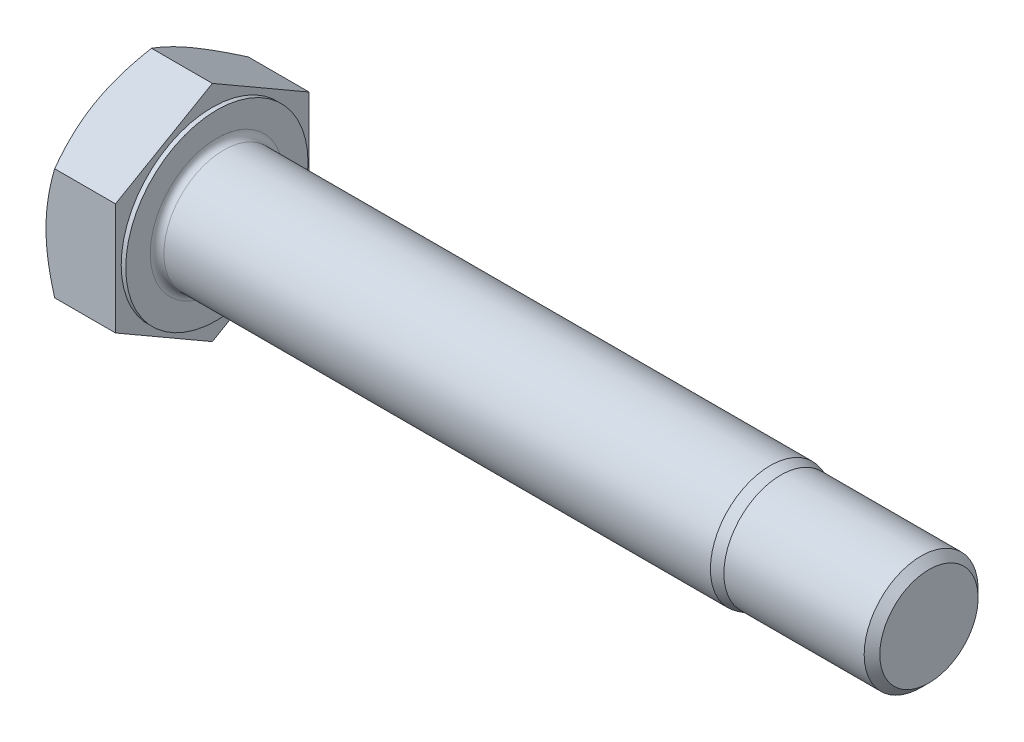
from build123d import *

# Parameters (mm, degrees)
BASEHEAD_DEPTH = 13
SKETCH4_W      = 0.8
SKETCH4_H      = 3.629909152
HEADFILLET_R   = 1.2


with BuildPart() as part:
    # HeadSke → BaseHead (new body)
    with BuildSketch(Plane(origin=(0, 0, 0), x_dir=(0, 0, -1), z_dir=(1, 0, 0))):
        Polygon((17, 9.814954576), (17, -9.814954576), (0, -19.629909152), (-17, -9.814954576), (-17, 9.814954576), (0, 19.629909152), align=None)
    extrude(amount=BASEHEAD_DEPTH)

    # BodySke → BaseBody (revolve)
    with BuildSketch(Plane.XY):
        Polygon((0, 10.5), (0, 0), (138, 0), (138, 8.626), (136.626, 10), (112, 10), (110.133974596, 10.5), align=None)
    revolve(axis=Axis((0, 0, 0), (1, 0, 0)))

    # Sketch3 → HeadChamfer (revolve, cut)
    with BuildSketch(Plane(origin=(0, 0, 0), x_dir=(1, 0, 0), z_dir=(0, 1, 0))):
        Polygon((4.25, 24.361215932), (-4.25, 9.638784068), (-11.424013371, 13.780702619), (-2.924013371, 28.503134483), align=None)
    revolve(axis=Axis((0, 0, 0), (1, 0, 0)), mode=Mode.SUBTRACT)

    # Sketch4 → BearingFace (revolve, cut)
    with BuildSketch(Plane.XY):
        with Locations((12.6, 17.814954576)):
            Rectangle(SKETCH4_W, SKETCH4_H)
    revolve(axis=Axis((0, 0, 0), (1, 0, 0)), mode=Mode.SUBTRACT)

    # HeadFillet
    headfillet_edges = [part.edges().sort_by_distance(p)[0] for p in [
        (13, -10.5, 0),
    ]]
    fillet(headfillet_edges, radius=HEADFILLET_R)


solid = part.part
